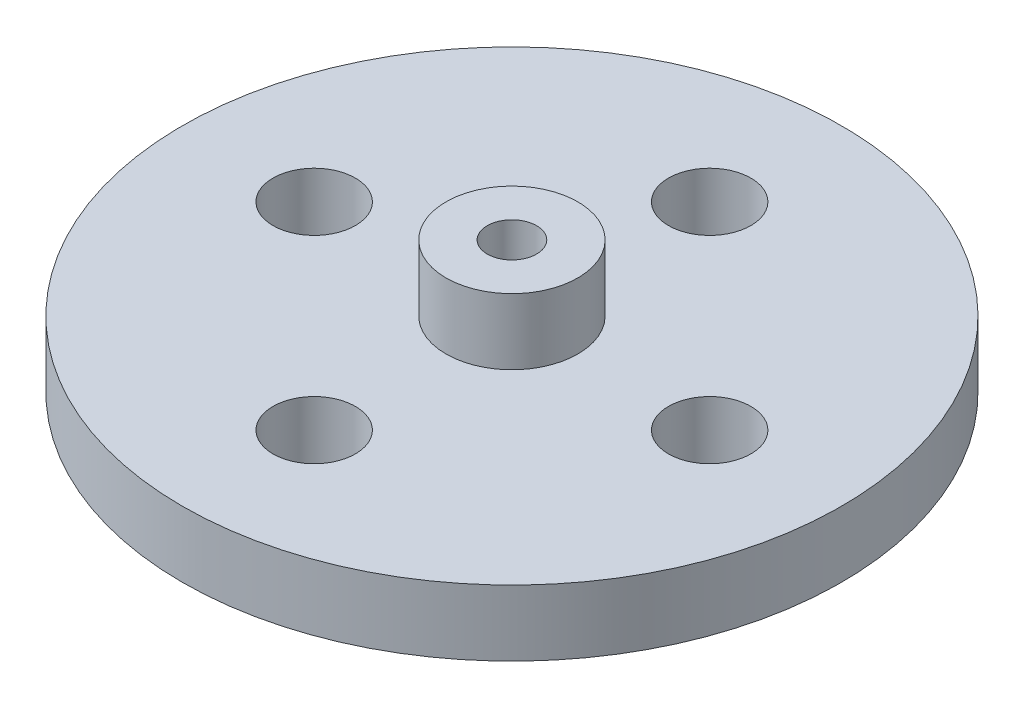
from build123d import *

# Parameters (mm, degrees)
SKETCH1_R                   = 31.75
BOSS_EXTRUDE1_DEPTH         = 6.35
SKETCH2_R                   = 6.35
BOSS_EXTRUDE2_DEPTH         = 6.35
SKETCH3_R                   = 2.3749
CUT_EXTRUDE1_DEPTH          = 47.6627796
F_3_8_16_TAPPED_HOLE1_D     = 7.9375
F_3_8_16_TAPPED_HOLE1_DEPTH = 26.924
F_3_8_16_TAPPED_HOLE1_TIP   = 2.384665582


with BuildPart() as part:
    # Sketch1 → Boss-Extrude1 (new body)
    with BuildSketch(Plane(origin=(0, 0, 0), x_dir=(1, 0, 0), z_dir=(0, 1, 0))):
        Circle(SKETCH1_R)
    extrude(amount=BOSS_EXTRUDE1_DEPTH)

    # Sketch2 → Boss-Extrude2 (add)
    with BuildSketch(Plane(origin=(0, 6.35, 0), x_dir=(1, 0, 0), z_dir=(0, 1, 0))):
        Circle(SKETCH2_R)
    extrude(amount=BOSS_EXTRUDE2_DEPTH)

    # Sketch3 → Cut-Extrude1 (cut, through all)
    with BuildSketch(Plane(origin=(0, 12.7, 0), x_dir=(1, 0, 0), z_dir=(0, 1, 0))):
        Circle(SKETCH3_R)
    extrude(amount=-CUT_EXTRUDE1_DEPTH, mode=Mode.SUBTRACT)

    # 3/8-16 Tapped Hole1
    with Locations(Plane(origin=(0, 6.35, 0), x_dir=(1, 0, 0), z_dir=(0, 1, 0))):
        with Locations((0, 19.05), (19.05, 0), (0, -19.05), (-19.05, 0)):
            Hole(F_3_8_16_TAPPED_HOLE1_D / 2, depth=F_3_8_16_TAPPED_HOLE1_DEPTH)
            with Locations((0, 0, -(F_3_8_16_TAPPED_HOLE1_DEPTH + F_3_8_16_TAPPED_HOLE1_TIP / 2))):  # 118° drill point
                Cone(0, F_3_8_16_TAPPED_HOLE1_D / 2, F_3_8_16_TAPPED_HOLE1_TIP, mode=Mode.SUBTRACT)


solid = part.part
